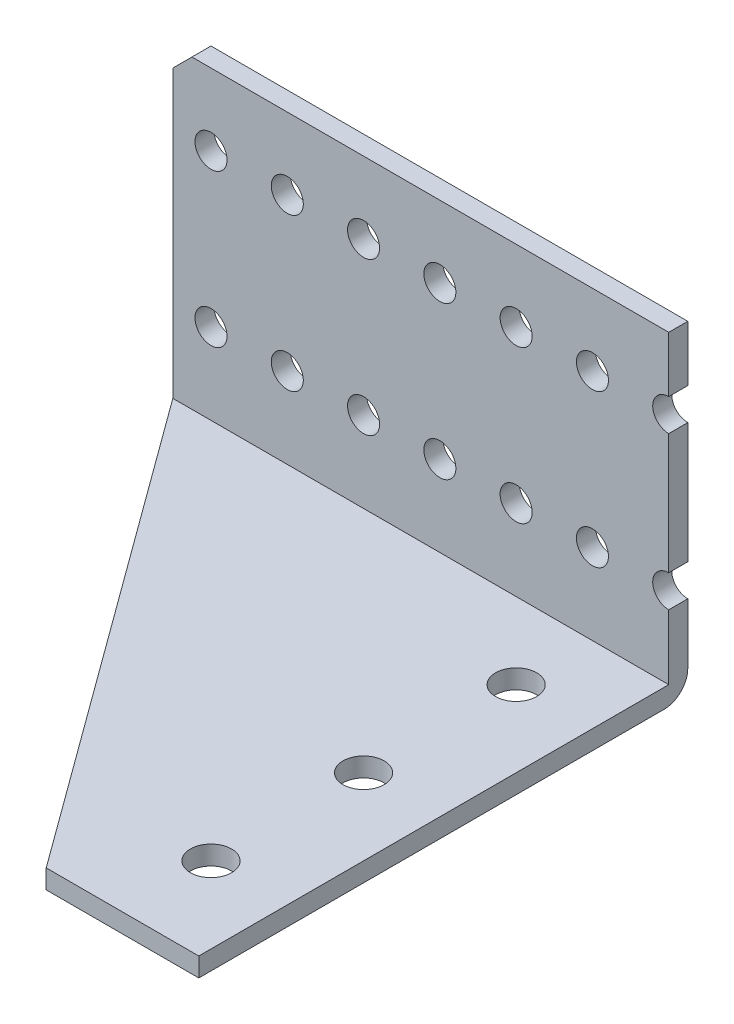
from build123d import *

# Parameters (mm, degrees)
BOSS_EXTRUDE1_START    = -34.925
SKETCH1_W              = 82.55
SKETCH1_H              = 81.407
BOSS_EXTRUDE1_DEPTH    = 3.175
SKETCH3_W              = 82.55
SKETCH3_H              = 3.175
BOSS_EXTRUDE2_DEPTH    = 50.8
F_10_CLEARANCE_HOLE2_D = 5.334
CHAMFER1_SIZE          = 3.175
FILLET2_R              = 3.937
SKETCH9_R              = 3.429
CUT_EXTRUDE2_DEPTH     = 80.206698973


with BuildPart() as part:
    # Sketch1 → Boss-Extrude1 (new body)
    with BuildSketch(Plane(origin=(0, 0, 0), x_dir=(1, 0, 0), z_dir=(0, 1, 0)).offset(BOSS_EXTRUDE1_START)):
        Rectangle(SKETCH1_W, SKETCH1_H)
    extrude(amount=BOSS_EXTRUDE1_DEPTH)

    # Sketch3 → Boss-Extrude2 (add)
    with BuildSketch(Plane(origin=(0, -31.75, 0), x_dir=(1, 0, 0), z_dir=(0, 1, 0))):
        with Locations((0, 39.116)):
            Rectangle(SKETCH3_W, SKETCH3_H)
    extrude(amount=BOSS_EXTRUDE2_DEPTH)

    # #10 Clearance Hole2 (through all)
    with Locations(Plane(origin=(0, 0, -40.7035), x_dir=(-1, 0, 0), z_dir=(0, 0, -1))):
        with Locations((22.225, 7.112), (9.525, 7.112), (-3.175, 7.112), (-15.875, 7.112), (-28.575, 7.112), (22.225, -18.288), (9.525, -18.288), (-3.175, -18.288), (-15.875, -18.288), (-28.575, -18.288), (34.925, 7.112), (34.925, -18.288), (-41.275, 7.112), (-41.275, -18.288)):
            Hole(F_10_CLEARANCE_HOLE2_D / 2)

    # Chamfer1
    chamfer1_edges = [part.edges().sort_by_distance(p)[0] for p in [
        (-41.275, 19.05, -39.116),
    ]]
    chamfer(chamfer1_edges, length=CHAMFER1_SIZE)

    # Fillet2
    fillet2_edges = [part.edges().sort_by_distance(p)[0] for p in [
        (0, -34.925, -40.7035),
    ]]
    fillet(fillet2_edges, radius=FILLET2_R)

    # Sketch9 → Cut-Extrude2 (cut, through all)
    with BuildSketch(Plane.XZ.offset(34.925)):
        with Locations((28.575, -24.8285)):
            Circle(SKETCH9_R)
        with Locations((28.575, 0.5715)):
            Circle(SKETCH9_R)
        with Locations((28.575, 25.9715)):
            Circle(SKETCH9_R)
        Polygon((-41.275, -37.5285), (-41.275, 40.7035), (15.875, 40.7035), align=None)
    extrude(amount=-CUT_EXTRUDE2_DEPTH, mode=Mode.SUBTRACT)


solid = part.part
